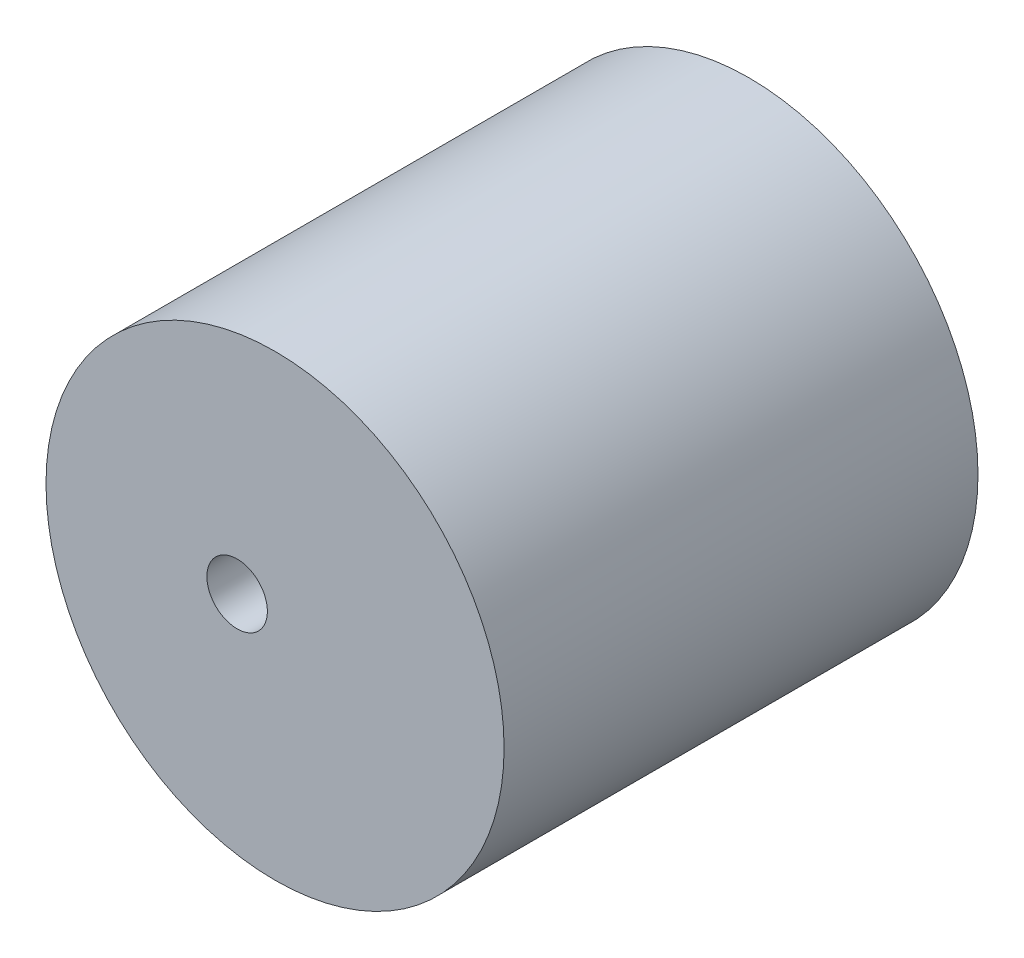
from build123d import *

# Parameters (mm, degrees)
SKETCH1_R            = 24.165625
SKETCH1_R_2          = 3.193125
BOSS_EXTRUDE5_DEPTH  = 50
SKETCH6_R            = 23.453125
SKETCH6_R_2          = 3.290625
BOSS_EXTRUDE9_DEPTH  = 2
SKETCH7_R            = 24.165625
SKETCH7_R_2          = 3.306875
BOSS_EXTRUDE10_DEPTH = 2


with BuildPart() as part:
    # Sketch1 → Boss-Extrude5 (new body)
    with BuildSketch(Plane.XY):
        Circle(SKETCH1_R)
        with Locations((-4, 0)):
            Circle(SKETCH1_R_2, mode=Mode.SUBTRACT)
    extrude(amount=BOSS_EXTRUDE5_DEPTH)

    # Sketch6 → Boss-Extrude9 (add)
    with BuildSketch(Plane.XY):
        Circle(SKETCH6_R)
        with Locations((-4, 0)):
            Circle(SKETCH6_R_2, mode=Mode.SUBTRACT)
    extrude(amount=BOSS_EXTRUDE9_DEPTH)

    # Sketch7 → Boss-Extrude10 (add)
    with BuildSketch(Plane.XY):
        Circle(SKETCH7_R)
        with Locations((-4, 0)):
            Circle(SKETCH7_R_2, mode=Mode.SUBTRACT)
    extrude(amount=BOSS_EXTRUDE10_DEPTH)


solid = part.part
